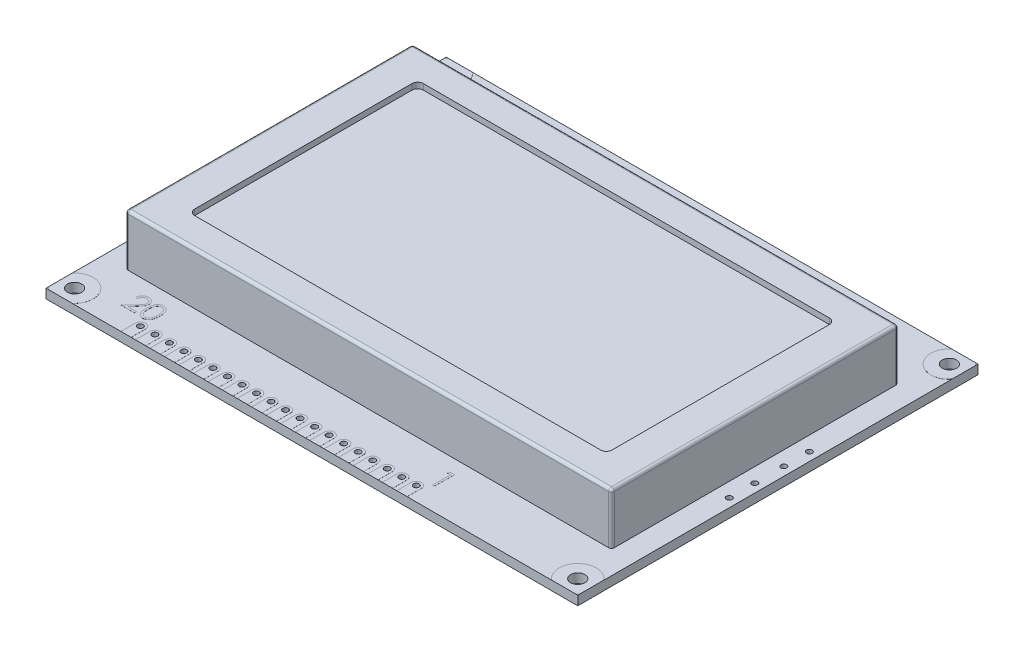
from build123d import *

# Parameters (mm, degrees)
SKETCH1_W                = 93
SKETCH1_H                = 70
SKETCH1_R                = 1.25
SKETCH1_R_2              = 0.5
BOSS_EXTRUDE1_DEPTH      = 1.6
BOSS_EXTRUDE2_DEPTH      = 1.61
BOSS_EXTRUDE2_DEPTH_BACK = 0.01
SKETCH4_R                = 0.5
SKETCH4_R_2              = 1.25
BOSS_EXTRUDE3_START      = 1.6
SKETCH5_W                = 85
SKETCH5_H                = 50.2
BOSS_EXTRUDE3_DEPTH      = 9
FILLET1_R                = 0.5
CUT_EXTRUDE1_START       = 10.6
CUT_EXTRUDE1_DEPTH       = 1
BOSS_EXTRUDE4_START      = 1.6
BOSS_EXTRUDE4_DEPTH      = 0.01
SKETCH8_R                = 7.5
BOSS_EXTRUDE5_DEPTH      = 3
FILLET2_R                = 9


with BuildPart() as part:
    # Sketch1 → Boss-Extrude1 (new body)
    with BuildSketch(Plane(origin=(0, 0, 0), x_dir=(1, 0, 0), z_dir=(0, 1, 0))):
        with Locations((46.5, 35)):
            Rectangle(SKETCH1_W, SKETCH1_H)
        with Locations(Location((2.5, 67.5, 0), (0, 0, 270))):
            Circle(SKETCH1_R, mode=Mode.SUBTRACT)
        with Locations(Location((90.5, 67.5, 0), (0, 0, 270))):
            Circle(SKETCH1_R, mode=Mode.SUBTRACT)
        with Locations(Location((90.5, 2.5, 0), (0, 0, 270))):
            Circle(SKETCH1_R, mode=Mode.SUBTRACT)
        with Locations(Location((2.5, 2.5, 0), (0, 0, 270))):
            Circle(SKETCH1_R, mode=Mode.SUBTRACT)
        with Locations(Location((14, 2.5, 0), (0, 0, 270))):
            Circle(SKETCH1_R_2, mode=Mode.SUBTRACT)
        with Locations(Location((16.54, 2.5, 0), (0, 0, 270))):
            Circle(SKETCH1_R_2, mode=Mode.SUBTRACT)
        with Locations(Location((19.08, 2.5, 0), (0, 0, 270))):
            Circle(SKETCH1_R_2, mode=Mode.SUBTRACT)
        with Locations(Location((21.62, 2.5, 0), (0, 0, 270))):
            Circle(SKETCH1_R_2, mode=Mode.SUBTRACT)
        with Locations(Location((24.16, 2.5, 0), (0, 0, 270))):
            Circle(SKETCH1_R_2, mode=Mode.SUBTRACT)
        with Locations(Location((26.7, 2.5, 0), (0, 0, 270))):
            Circle(SKETCH1_R_2, mode=Mode.SUBTRACT)
        with Locations(Location((29.24, 2.5, 0), (0, 0, 270))):
            Circle(SKETCH1_R_2, mode=Mode.SUBTRACT)
        with Locations(Location((31.78, 2.5, 0), (0, 0, 270))):
            Circle(SKETCH1_R_2, mode=Mode.SUBTRACT)
        with Locations(Location((34.32, 2.5, 0), (0, 0, 270))):
            Circle(SKETCH1_R_2, mode=Mode.SUBTRACT)
        with Locations(Location((36.86, 2.5, 0), (0, 0, 270))):
            Circle(SKETCH1_R_2, mode=Mode.SUBTRACT)
        with Locations(Location((39.4, 2.5, 0), (0, 0, 270))):
            Circle(SKETCH1_R_2, mode=Mode.SUBTRACT)
        with Locations(Location((41.94, 2.5, 0), (0, 0, 270))):
            Circle(SKETCH1_R_2, mode=Mode.SUBTRACT)
        with Locations(Location((44.48, 2.5, 0), (0, 0, 270))):
            Circle(SKETCH1_R_2, mode=Mode.SUBTRACT)
        with Locations(Location((47.02, 2.5, 0), (0, 0, 270))):
            Circle(SKETCH1_R_2, mode=Mode.SUBTRACT)
        with Locations(Location((49.56, 2.5, 0), (0, 0, 270))):
            Circle(SKETCH1_R_2, mode=Mode.SUBTRACT)
        with Locations(Location((52.1, 2.5, 0), (0, 0, 270))):
            Circle(SKETCH1_R_2, mode=Mode.SUBTRACT)
        with Locations(Location((54.64, 2.5, 0), (0, 0, 270))):
            Circle(SKETCH1_R_2, mode=Mode.SUBTRACT)
        with Locations(Location((57.18, 2.5, 0), (0, 0, 270))):
            Circle(SKETCH1_R_2, mode=Mode.SUBTRACT)
        with Locations(Location((59.72, 2.5, 0), (0, 0, 270))):
            Circle(SKETCH1_R_2, mode=Mode.SUBTRACT)
        with Locations(Location((62.26, 2.5, 0), (0, 0, 270))):
            Circle(SKETCH1_R_2, mode=Mode.SUBTRACT)
        with Locations(Location((91.5, 42, 0), (0, 0, 270))):
            Circle(SKETCH1_R_2, mode=Mode.SUBTRACT)
        with Locations(Location((91.5, 37.54, 0), (0, 0, 270))):
            Circle(SKETCH1_R_2, mode=Mode.SUBTRACT)
        with Locations(Location((91.5, 32.46, 0), (0, 0, 270))):
            Circle(SKETCH1_R_2, mode=Mode.SUBTRACT)
        with Locations(Location((91.5, 28, 0), (0, 0, 270))):
            Circle(SKETCH1_R_2, mode=Mode.SUBTRACT)
    extrude(amount=BOSS_EXTRUDE1_DEPTH)

    # Sketch4 → Boss-Extrude2 (add, two sides: drawn at the far end of the back side and taken through both)
    # profile 1 of 24: a face of its own
    with BuildSketch(Plane(origin=(0, 0, 0), x_dir=(1, 0, 0), z_dir=(0, 1, 0)).offset(-BOSS_EXTRUDE2_DEPTH_BACK)):
        with BuildLine():
            Line((13.1, 2.5), (13.1, 0))
            Line((13.1, 0), (14.9, 0))
            Line((14.9, 0), (14.9, 2.5))
            ThreePointArc((14.9, 2.5), (14, 3.4), (13.1, 2.5))
        make_face()
        with Locations(Location((14, 2.5, 0), (0, 0, 270))):
            Circle(SKETCH4_R, mode=Mode.SUBTRACT)
    # profile 2 of 24: a face of its own
    with BuildSketch(Plane(origin=(0, 0, 0), x_dir=(1, 0, 0), z_dir=(0, 1, 0)).offset(-BOSS_EXTRUDE2_DEPTH_BACK)):
        with BuildLine():
            Line((15.64, 2.5), (15.64, 0))
            Line((15.64, 0), (17.44, 0))
            Line((17.44, 0), (17.44, 2.5))
            ThreePointArc((17.44, 2.5), (16.54, 3.4), (15.64, 2.5))
        make_face()
        with Locations(Location((16.54, 2.5, 0), (0, 0, 270))):
            Circle(SKETCH4_R, mode=Mode.SUBTRACT)
    # profile 3 of 24: a face of its own
    with BuildSketch(Plane(origin=(0, 0, 0), x_dir=(1, 0, 0), z_dir=(0, 1, 0)).offset(-BOSS_EXTRUDE2_DEPTH_BACK)):
        with BuildLine():
            Line((18.18, 2.5), (18.18, 0))
            Line((18.18, 0), (19.98, 0))
            Line((19.98, 0), (19.98, 2.5))
            ThreePointArc((19.98, 2.5), (19.08, 3.4), (18.18, 2.5))
        make_face()
        with Locations(Location((19.08, 2.5, 0), (0, 0, 270))):
            Circle(SKETCH4_R, mode=Mode.SUBTRACT)
    # profile 4 of 24: a face of its own
    with BuildSketch(Plane(origin=(0, 0, 0), x_dir=(1, 0, 0), z_dir=(0, 1, 0)).offset(-BOSS_EXTRUDE2_DEPTH_BACK)):
        with BuildLine():
            Line((20.72, 2.5), (20.72, 0))
            Line((20.72, 0), (22.52, 0))
            Line((22.52, 0), (22.52, 2.5))
            ThreePointArc((22.52, 2.5), (21.62, 3.4), (20.72, 2.5))
        make_face()
        with Locations(Location((21.62, 2.5, 0), (0, 0, 270))):
            Circle(SKETCH4_R, mode=Mode.SUBTRACT)
    # profile 5 of 24: a face of its own
    with BuildSketch(Plane(origin=(0, 0, 0), x_dir=(1, 0, 0), z_dir=(0, 1, 0)).offset(-BOSS_EXTRUDE2_DEPTH_BACK)):
        with BuildLine():
            Line((23.26, 2.5), (23.26, 0))
            Line((23.26, 0), (25.06, 0))
            Line((25.06, 0), (25.06, 2.5))
            ThreePointArc((25.06, 2.5), (24.16, 3.4), (23.26, 2.5))
        make_face()
        with Locations(Location((24.16, 2.5, 0), (0, 0, 270))):
            Circle(SKETCH4_R, mode=Mode.SUBTRACT)
    # profile 6 of 24: a face of its own
    with BuildSketch(Plane(origin=(0, 0, 0), x_dir=(1, 0, 0), z_dir=(0, 1, 0)).offset(-BOSS_EXTRUDE2_DEPTH_BACK)):
        with BuildLine():
            Line((25.8, 2.5), (25.8, 0))
            Line((25.8, 0), (27.6, 0))
            Line((27.6, 0), (27.6, 2.5))
            ThreePointArc((27.6, 2.5), (26.7, 3.4), (25.8, 2.5))
        make_face()
        with Locations(Location((26.7, 2.5, 0), (0, 0, 270))):
            Circle(SKETCH4_R, mode=Mode.SUBTRACT)
    # profile 7 of 24: a face of its own
    with BuildSketch(Plane(origin=(0, 0, 0), x_dir=(1, 0, 0), z_dir=(0, 1, 0)).offset(-BOSS_EXTRUDE2_DEPTH_BACK)):
        with BuildLine():
            Line((28.34, 2.5), (28.34, 0))
            Line((28.34, 0), (30.14, 0))
            Line((30.14, 0), (30.14, 2.5))
            ThreePointArc((30.14, 2.5), (29.24, 3.4), (28.34, 2.5))
        make_face()
        with Locations(Location((29.24, 2.5, 0), (0, 0, 270))):
            Circle(SKETCH4_R, mode=Mode.SUBTRACT)
    # profile 8 of 24: a face of its own
    with BuildSketch(Plane(origin=(0, 0, 0), x_dir=(1, 0, 0), z_dir=(0, 1, 0)).offset(-BOSS_EXTRUDE2_DEPTH_BACK)):
        with BuildLine():
            Line((30.88, 2.5), (30.88, 0))
            Line((30.88, 0), (32.68, 0))
            Line((32.68, 0), (32.68, 2.5))
            ThreePointArc((32.68, 2.5), (31.78, 3.4), (30.88, 2.5))
        make_face()
        with Locations(Location((31.78, 2.5, 0), (0, 0, 270))):
            Circle(SKETCH4_R, mode=Mode.SUBTRACT)
    # profile 9 of 24: a face of its own
    with BuildSketch(Plane(origin=(0, 0, 0), x_dir=(1, 0, 0), z_dir=(0, 1, 0)).offset(-BOSS_EXTRUDE2_DEPTH_BACK)):
        with BuildLine():
            Line((33.42, 2.5), (33.42, 0))
            Line((33.42, 0), (35.22, 0))
            Line((35.22, 0), (35.22, 2.5))
            ThreePointArc((35.22, 2.5), (34.32, 3.4), (33.42, 2.5))
        make_face()
        with Locations(Location((34.32, 2.5, 0), (0, 0, 270))):
            Circle(SKETCH4_R, mode=Mode.SUBTRACT)
    # profile 10 of 24: a face of its own
    with BuildSketch(Plane(origin=(0, 0, 0), x_dir=(1, 0, 0), z_dir=(0, 1, 0)).offset(-BOSS_EXTRUDE2_DEPTH_BACK)):
        with BuildLine():
            Line((35.96, 2.5), (35.96, 0))
            Line((35.96, 0), (37.76, 0))
            Line((37.76, 0), (37.76, 2.5))
            ThreePointArc((37.76, 2.5), (36.86, 3.4), (35.96, 2.5))
        make_face()
        with Locations(Location((36.86, 2.5, 0), (0, 0, 270))):
            Circle(SKETCH4_R, mode=Mode.SUBTRACT)
    # profile 11 of 24: a face of its own
    with BuildSketch(Plane(origin=(0, 0, 0), x_dir=(1, 0, 0), z_dir=(0, 1, 0)).offset(-BOSS_EXTRUDE2_DEPTH_BACK)):
        with BuildLine():
            Line((38.5, 2.5), (38.5, 0))
            Line((38.5, 0), (40.3, 0))
            Line((40.3, 0), (40.3, 2.5))
            ThreePointArc((40.3, 2.5), (39.4, 3.4), (38.5, 2.5))
        make_face()
        with Locations(Location((39.4, 2.5, 0), (0, 0, 270))):
            Circle(SKETCH4_R, mode=Mode.SUBTRACT)
    # profile 12 of 24: a face of its own
    with BuildSketch(Plane(origin=(0, 0, 0), x_dir=(1, 0, 0), z_dir=(0, 1, 0)).offset(-BOSS_EXTRUDE2_DEPTH_BACK)):
        with BuildLine():
            Line((41.04, 2.5), (41.04, 0))
            Line((41.04, 0), (42.84, 0))
            Line((42.84, 0), (42.84, 2.5))
            ThreePointArc((42.84, 2.5), (41.94, 3.4), (41.04, 2.5))
        make_face()
        with Locations(Location((41.94, 2.5, 0), (0, 0, 270))):
            Circle(SKETCH4_R, mode=Mode.SUBTRACT)
    # profile 13 of 24: a face of its own
    with BuildSketch(Plane(origin=(0, 0, 0), x_dir=(1, 0, 0), z_dir=(0, 1, 0)).offset(-BOSS_EXTRUDE2_DEPTH_BACK)):
        with BuildLine():
            Line((43.58, 2.5), (43.58, 0))
            Line((43.58, 0), (45.38, 0))
            Line((45.38, 0), (45.38, 2.5))
            ThreePointArc((45.38, 2.5), (44.48, 3.4), (43.58, 2.5))
        make_face()
        with Locations(Location((44.48, 2.5, 0), (0, 0, 270))):
            Circle(SKETCH4_R, mode=Mode.SUBTRACT)
    # profile 14 of 24: a face of its own
    with BuildSketch(Plane(origin=(0, 0, 0), x_dir=(1, 0, 0), z_dir=(0, 1, 0)).offset(-BOSS_EXTRUDE2_DEPTH_BACK)):
        with BuildLine():
            Line((46.12, 2.5), (46.12, 0))
            Line((46.12, 0), (47.92, 0))
            Line((47.92, 0), (47.92, 2.5))
            ThreePointArc((47.92, 2.5), (47.02, 3.4), (46.12, 2.5))
        make_face()
        with Locations(Location((47.02, 2.5, 0), (0, 0, 270))):
            Circle(SKETCH4_R, mode=Mode.SUBTRACT)
    # profile 15 of 24: a face of its own
    with BuildSketch(Plane(origin=(0, 0, 0), x_dir=(1, 0, 0), z_dir=(0, 1, 0)).offset(-BOSS_EXTRUDE2_DEPTH_BACK)):
        with BuildLine():
            Line((48.66, 2.5), (48.66, 0))
            Line((48.66, 0), (50.46, 0))
            Line((50.46, 0), (50.46, 2.5))
            ThreePointArc((50.46, 2.5), (49.56, 3.4), (48.66, 2.5))
        make_face()
        with Locations(Location((49.56, 2.5, 0), (0, 0, 270))):
            Circle(SKETCH4_R, mode=Mode.SUBTRACT)
    # profile 16 of 24: a face of its own
    with BuildSketch(Plane(origin=(0, 0, 0), x_dir=(1, 0, 0), z_dir=(0, 1, 0)).offset(-BOSS_EXTRUDE2_DEPTH_BACK)):
        with BuildLine():
            Line((51.2, 2.5), (51.2, 0))
            Line((51.2, 0), (53, 0))
            Line((53, 0), (53, 2.5))
            ThreePointArc((53, 2.5), (52.1, 3.4), (51.2, 2.5))
        make_face()
        with Locations(Location((52.1, 2.5, 0), (0, 0, 270))):
            Circle(SKETCH4_R, mode=Mode.SUBTRACT)
    # profile 17 of 24: a face of its own
    with BuildSketch(Plane(origin=(0, 0, 0), x_dir=(1, 0, 0), z_dir=(0, 1, 0)).offset(-BOSS_EXTRUDE2_DEPTH_BACK)):
        with BuildLine():
            Line((53.74, 2.5), (53.74, 0))
            Line((53.74, 0), (55.54, 0))
            Line((55.54, 0), (55.54, 2.5))
            ThreePointArc((55.54, 2.5), (54.64, 3.4), (53.74, 2.5))
        make_face()
        with Locations(Location((54.64, 2.5, 0), (0, 0, 270))):
            Circle(SKETCH4_R, mode=Mode.SUBTRACT)
    # profile 18 of 24: a face of its own
    with BuildSketch(Plane(origin=(0, 0, 0), x_dir=(1, 0, 0), z_dir=(0, 1, 0)).offset(-BOSS_EXTRUDE2_DEPTH_BACK)):
        with BuildLine():
            Line((56.28, 2.5), (56.28, 0))
            Line((56.28, 0), (58.08, 0))
            Line((58.08, 0), (58.08, 2.5))
            ThreePointArc((58.08, 2.5), (57.18, 3.4), (56.28, 2.5))
        make_face()
        with Locations(Location((57.18, 2.5, 0), (0, 0, 270))):
            Circle(SKETCH4_R, mode=Mode.SUBTRACT)
    # profile 19 of 24: a face of its own
    with BuildSketch(Plane(origin=(0, 0, 0), x_dir=(1, 0, 0), z_dir=(0, 1, 0)).offset(-BOSS_EXTRUDE2_DEPTH_BACK)):
        with BuildLine():
            Line((58.82, 2.5), (58.82, 0))
            Line((58.82, 0), (60.62, 0))
            Line((60.62, 0), (60.62, 2.5))
            ThreePointArc((60.62, 2.5), (59.72, 3.4), (58.82, 2.5))
        make_face()
        with Locations(Location((59.72, 2.5, 0), (0, 0, 270))):
            Circle(SKETCH4_R, mode=Mode.SUBTRACT)
    # profile 20 of 24: a face of its own
    with BuildSketch(Plane(origin=(0, 0, 0), x_dir=(1, 0, 0), z_dir=(0, 1, 0)).offset(-BOSS_EXTRUDE2_DEPTH_BACK)):
        with BuildLine():
            Line((61.36, 2.5), (61.36, 0))
            Line((61.36, 0), (63.16, 0))
            Line((63.16, 0), (63.16, 2.5))
            ThreePointArc((63.16, 2.5), (62.26, 3.4), (61.36, 2.5))
        make_face()
        with Locations(Location((62.26, 2.5, 0), (0, 0, 270))):
            Circle(SKETCH4_R, mode=Mode.SUBTRACT)
    # profile 21 of 24: a face of its own
    with BuildSketch(Plane(origin=(0, 0, 0), x_dir=(1, 0, 0), z_dir=(0, 1, 0)).offset(-BOSS_EXTRUDE2_DEPTH_BACK)):
        with BuildLine():
            Line((0, 4.576655966), (0, 0.423344034))
            ThreePointArc((0, 0.423344034), (0.201902961, 0.201902961), (0.423344034, 0))
            Line((0.423344034, 0), (4.576655966, 0))
            ThreePointArc((4.576655966, 0), (4.798097039, 4.798097039), (0, 4.576655966))
        make_face()
        with Locations(Location((2.5, 2.5, 0), (0, 0, 270))):
            Circle(SKETCH4_R_2, mode=Mode.SUBTRACT)
    # profile 22 of 24: a face of its own
    with BuildSketch(Plane(origin=(0, 0, 0), x_dir=(1, 0, 0), z_dir=(0, 1, 0)).offset(-BOSS_EXTRUDE2_DEPTH_BACK)):
        with BuildLine():
            Line((4.576655966, 70), (0.423344034, 70))
            ThreePointArc((0.423344034, 70), (0.201902961, 69.798097039), (0, 69.576655966))
            Line((0, 69.576655966), (0, 65.423344034))
            ThreePointArc((0, 65.423344034), (4.798097039, 65.201902961), (4.576655966, 70))
        make_face()
        with Locations(Location((2.5, 67.5, 0), (0, 0, 270))):
            Circle(SKETCH4_R_2, mode=Mode.SUBTRACT)
    # profile 23 of 24: a face of its own
    with BuildSketch(Plane(origin=(0, 0, 0), x_dir=(1, 0, 0), z_dir=(0, 1, 0)).offset(-BOSS_EXTRUDE2_DEPTH_BACK)):
        with BuildLine():
            Line((88.423344034, 70), (92.576655966, 70))
            ThreePointArc((92.576655966, 70), (92.798097039, 69.798097039), (93, 69.576655966))
            Line((93, 69.576655966), (93, 65.423344034))
            ThreePointArc((93, 65.423344034), (88.201902961, 65.201902961), (88.423344034, 70))
        make_face()
        with Locations(Location((90.5, 67.5, 0), (0, 0, 270))):
            Circle(SKETCH4_R_2, mode=Mode.SUBTRACT)
    # profile 24 of 24: a face of its own
    with BuildSketch(Plane(origin=(0, 0, 0), x_dir=(1, 0, 0), z_dir=(0, 1, 0)).offset(-BOSS_EXTRUDE2_DEPTH_BACK)):
        with BuildLine():
            Line((88.423344034, 0), (92.576655966, 0))
            ThreePointArc((92.576655966, 0), (92.798097039, 0.201902961), (93, 0.423344034))
            Line((93, 0.423344034), (93, 4.576655966))
            ThreePointArc((93, 4.576655966), (88.201902961, 4.798097039), (88.423344034, 0))
        make_face()
        with Locations(Location((90.5, 2.5, 0), (0, 0, 270))):
            Circle(SKETCH4_R_2, mode=Mode.SUBTRACT)
    extrude(amount=BOSS_EXTRUDE2_DEPTH + BOSS_EXTRUDE2_DEPTH_BACK)

    # Sketch5 → Boss-Extrude3 (add)
    with BuildSketch(Plane(origin=(0, 0, 0), x_dir=(1, 0, 0), z_dir=(0, 1, 0)).offset(BOSS_EXTRUDE3_START)):
        with Locations((46.5, 35)):
            Rectangle(SKETCH5_W, SKETCH5_H)
    extrude(amount=BOSS_EXTRUDE3_DEPTH)

    # Fillet1
    fillet1_edges = [part.edges().sort_by_distance(p)[0] for p in [
        (4, 6.1, -9.9),
        (89, 6.1, -9.9),
        (89, 6.1, -60.1),
        (4, 6.1, -60.1),
        (46.5, 10.6, -9.9),
        (89, 10.6, -35),
        (46.5, 10.6, -60.1),
        (4, 10.6, -35),
    ]]
    fillet(fillet1_edges, radius=FILLET1_R)

    # Sketch6 → Cut-Extrude1 (cut)
    with BuildSketch(Plane(origin=(0, 0, 0), x_dir=(1, 0, 0), z_dir=(0, 1, 0)).offset(CUT_EXTRUDE1_START)):
        with BuildLine():
            Line((11, 55), (82, 55))
            ThreePointArc((82, 55), (82.707106781, 54.707106781), (83, 54))
            Line((83, 54), (83, 16))
            ThreePointArc((83, 16), (82.707106781, 15.292893219), (82, 15))
            Line((82, 15), (11, 15))
            ThreePointArc((11, 15), (10.292893219, 15.292893219), (10, 16))
            Line((10, 16), (10, 54))
            ThreePointArc((10, 54), (10.292893219, 54.707106781), (11, 55))
        make_face()
    extrude(amount=-CUT_EXTRUDE1_DEPTH, mode=Mode.SUBTRACT)

    # Sketch7 → Boss-Extrude4 (add)
    # profile 1 of 3: a face of its own
    with BuildSketch(Plane(origin=(0, 0, 0), x_dir=(1, 0, 0), z_dir=(0, 1, 0)).offset(BOSS_EXTRUDE4_START)):
        Polygon((63.31493189, 7.465834386), (63.962067306, 7.465834386), (63.962067306, 3.965834386), (63.647964742, 3.965834386), (63.647964742, 7.106860027), (63.109503204, 7.106860027), align=None)
    # profile 2 of 3: a face of its own
    with BuildSketch(Plane(origin=(0, 0, 0), x_dir=(1, 0, 0), z_dir=(0, 1, 0)).offset(BOSS_EXTRUDE4_START)):
        with BuildLine():
            Line((9.57822358, 6.421604631), (9.264121016, 6.421604631))
            add(Edge.make_bspline(
                [(9.264121016, 6.421604631), (9.266168169, 6.463275519), (9.270188723, 6.545116033), (9.289017012, 6.66443994), (9.315957889, 6.778494738), (9.354049343, 6.886364652), (9.401355621, 6.98900346), (9.458085649, 7.086003475), (9.525279499, 7.176994664), (9.601486233, 7.261133507), (9.684254872, 7.338321078), (9.773560812, 7.404976321), (9.867405839, 7.461293992), (9.965505238, 7.508375234), (10.068965801, 7.54371508), (10.176848659, 7.56993672), (10.289627796, 7.585713065), (10.366467818, 7.587408851), (10.405547298, 7.588271298)],
                knots=[0, 0, 0, 0, 1.10065271, 2.161652631, 3.183658789, 4.190468796, 5.17591951, 6.163126047, 7.15150782, 8.156236427, 9.156009102, 10.134482811, 11.092018607, 12.041330605, 13.001268258, 13.972401359, 14.968799086, 16, 16, 16, 16], degree=3))
            add(Edge.make_bspline(
                [(10.405547298, 7.588271298), (10.443925372, 7.587372841), (10.519336917, 7.585607406), (10.629398931, 7.570446377), (10.734176226, 7.546700786), (10.833463992, 7.513385369), (10.926470057, 7.468600942), (11.013893101, 7.414803403), (11.096773912, 7.352583572), (11.171380696, 7.279329758), (11.239888775, 7.201127374), (11.29899103, 7.11763947), (11.349604194, 7.031410185), (11.391791873, 6.941781983), (11.422848012, 6.847910955), (11.44642622, 6.751163752), (11.459753634, 6.650538941), (11.461799058, 6.582432385), (11.462838965, 6.547806554)],
                knots=[0, 0, 0, 0, 1.111607364, 2.184268762, 3.212621178, 4.221274766, 5.211760367, 6.196651075, 7.1921475, 8.207485113, 9.220403448, 10.201281604, 11.166441695, 12.114753415, 13.065576456, 14.026450734, 14.996634279, 16, 16, 16, 16], degree=3))
            add(Edge.make_bspline(
                [(11.462838965, 6.547806554), (11.461145702, 6.49905872), (11.45778889, 6.402418506), (11.429074514, 6.260403643), (11.384228003, 6.122810224), (11.330230646, 6.012072922), (11.275758202, 5.922839428), (11.226670694, 5.849370723), (11.169205883, 5.770265255), (11.102527385, 5.685787917), (11.028014513, 5.595277012), (10.94499235, 5.498787217), (10.852868868, 5.397315447), (10.788210367, 5.328009846), (10.754705952, 5.292097419)],
                knots=[0, 0, 0, 0, 1.184426356, 2.348067706, 3.509069118, 4.696110526, 5.333549288, 6.050745305, 6.844228056, 7.710549037, 8.667450064, 9.695053472, 10.805634456, 12, 12, 12, 12], degree=3))
            Line((10.754705952, 5.292097419), (9.87900483, 4.357502067))
            Line((9.87900483, 4.357502067), (11.50771076, 4.357502067))
            Line((11.50771076, 4.357502067), (11.50771076, 3.998527708))
            Line((11.50771076, 3.998527708), (9.129505631, 3.998527708))
            Line((9.129505631, 3.998527708), (10.486877426, 5.447045336))
            add(Edge.make_bspline(
                [(10.486877426, 5.447045336), (10.519925313, 5.481543643), (10.58340354, 5.547807829), (10.673186117, 5.644550789), (10.753825105, 5.73430033), (10.825842498, 5.816886879), (10.887676003, 5.893518446), (10.942548235, 5.96171315), (10.986513826, 6.0244676), (11.034229222, 6.097208214), (11.080443203, 6.186020531), (11.120155559, 6.294554221), (11.144370408, 6.406281473), (11.147275243, 6.48178351), (11.148736401, 6.519761682)],
                knots=[0, 0, 0, 0, 1.329631726, 2.553950428, 3.673215718, 4.687767853, 5.603093632, 6.413772471, 7.123043292, 7.734684054, 8.834405432, 9.900288307, 10.943827018, 12, 12, 12, 12], degree=3))
            add(Edge.make_bspline(
                [(11.148736401, 6.519761682), (11.148100658, 6.543643081), (11.146847732, 6.590708731), (11.135790035, 6.65971449), (11.119079529, 6.726279304), (11.095134271, 6.790607923), (11.063527531, 6.852053575), (11.025054151, 6.910691055), (10.980664087, 6.96738002), (10.929312818, 7.020533319), (10.872901298, 7.069214524), (10.813307048, 7.112338609), (10.750256944, 7.14837772), (10.684016822, 7.177921217), (10.614771353, 7.201096599), (10.542386608, 7.217155178), (10.467062591, 7.227237662), (10.415629096, 7.228601834), (10.389421497, 7.229296939)],
                knots=[0, 0, 0, 0, 0.991446411, 1.95395049, 2.89581595, 3.838931463, 4.798493298, 5.75982156, 6.748411868, 7.785213223, 8.824556874, 9.840280684, 10.836137867, 11.835679398, 12.848801643, 13.863922112, 14.911575587, 16, 16, 16, 16], degree=3))
            add(Edge.make_bspline(
                [(10.389421497, 7.229296939), (10.362050664, 7.228581906), (10.308298868, 7.227177701), (10.229379835, 7.217355037), (10.154094057, 7.200409197), (10.082252154, 7.177232522), (10.013732568, 7.147773974), (9.948868524, 7.111082229), (9.887805635, 7.067298736), (9.830429112, 7.017658179), (9.777565133, 6.962390578), (9.731118257, 6.900780615), (9.690534243, 6.8339532), (9.655125009, 6.762088649), (9.626369319, 6.684534869), (9.604396169, 6.601567164), (9.587009322, 6.513545783), (9.581200801, 6.452760698), (9.57822358, 6.421604631)],
                knots=[0, 0, 0, 0, 1.031018746, 2.02475058, 2.990194455, 3.934040569, 4.864654155, 5.795059489, 6.735614925, 7.690564532, 8.649604399, 9.611025574, 10.590972636, 11.591080095, 12.624614302, 13.701020113, 14.821632451, 16, 16, 16, 16], degree=3))
        make_face()
    # profile 3 of 3: a face of its own
    with BuildSketch(Plane(origin=(0, 0, 0), x_dir=(1, 0, 0), z_dir=(0, 1, 0)).offset(BOSS_EXTRUDE4_START)):
        with BuildLine():
            add(Edge.make_bspline(
                [(11.821813324, 5.747125464), (11.822141342, 5.803222852), (11.822778522, 5.912192836), (11.829866943, 6.070977478), (11.841642285, 6.219937767), (11.857779658, 6.359080833), (11.877417638, 6.488442598), (11.903633125, 6.607677355), (11.933445927, 6.717336962), (11.967998373, 6.81777901), (12.006986162, 6.910356713), (12.049420423, 6.996781914), (12.096985217, 7.076923847), (12.14696213, 7.152061637), (12.201374202, 7.220965332), (12.258672992, 7.284607995), (12.321094869, 7.341518745), (12.386517877, 7.393365047), (12.455534341, 7.438814519), (12.526177007, 7.478847258), (12.598932113, 7.513047125), (12.673998296, 7.539937561), (12.750700854, 7.562148408), (12.829307921, 7.577337355), (12.909949285, 7.586894264), (12.964380719, 7.587807931), (12.991985599, 7.588271298)],
                knots=[0, 0, 0, 0, 1.646270934, 3.197905019, 4.663502075, 6.030701355, 7.308322542, 8.50163776, 9.611534131, 10.641858119, 11.616356847, 12.558055219, 13.465016945, 14.349605745, 15.204443733, 16.039544428, 16.859896111, 17.680448484, 18.487036065, 19.28249412, 20.06191084, 20.843045899, 21.620316918, 22.403196591, 23.190181807, 24, 24, 24, 24], degree=3))
            add(Edge.make_bspline(
                [(12.991985599, 7.588271298), (13.019821078, 7.587783483), (13.075177087, 7.586813372), (13.157017462, 7.577489429), (13.236967144, 7.562018306), (13.314685282, 7.540097331), (13.390810269, 7.512901655), (13.464746676, 7.478814538), (13.536953758, 7.43913567), (13.606284046, 7.392511793), (13.673498661, 7.340529517), (13.736946624, 7.281766848), (13.79663371, 7.216817129), (13.853309015, 7.146375265), (13.905364612, 7.06909018), (13.954938045, 6.98630607), (13.999310081, 6.896575205), (14.042044756, 6.801394738), (14.078931742, 6.698131079), (14.112197988, 6.587366318), (14.139076956, 6.467792131), (14.161466229, 6.340035886), (14.178811125, 6.203628403), (14.191443767, 6.058862087), (14.198116852, 5.905641697), (14.199373553, 5.800883847), (14.200018452, 5.747125464)],
                knots=[0, 0, 0, 0, 0.810914788, 1.612654377, 2.396697861, 3.181598691, 3.963628158, 4.749916497, 5.551656086, 6.361998678, 7.18212741, 8.025565596, 8.878627764, 9.750805457, 10.657531673, 11.591944965, 12.560506719, 13.57287815, 14.630710178, 15.753379473, 16.941251878, 18.199788006, 19.531962791, 20.947069417, 22.433333509, 24, 24, 24, 24], degree=3))
            add(Edge.make_bspline(
                [(14.200018452, 5.747125464), (14.199366867, 5.693601556), (14.198097281, 5.589312405), (14.191518575, 5.436781429), (14.178559943, 5.292783386), (14.162349955, 5.156972923), (14.139898992, 5.029915305), (14.112293826, 4.911170856), (14.081643503, 4.800226785), (14.043808709, 4.697991973), (14.002397999, 4.60304025), (13.957342802, 4.514373102), (13.909072976, 4.431206809), (13.856484231, 4.354207062), (13.800430818, 4.282828405), (13.739713029, 4.218330782), (13.676042444, 4.15916011), (13.608630028, 4.106508483), (13.538218477, 4.060423678), (13.4662594, 4.019209828), (13.391476017, 3.985977133), (13.315563064, 3.957442092), (13.237434698, 3.93564164), (13.157188307, 3.920567784), (13.075232071, 3.909995936), (13.019830506, 3.909189456), (12.991985599, 3.908784118)],
                knots=[0, 0, 0, 0, 1.561518951, 3.042555995, 4.452378317, 5.7783523, 7.031515105, 8.214008947, 9.334062868, 10.386615937, 11.391082383, 12.354592575, 13.286541444, 14.194233754, 15.072674879, 15.931287219, 16.775624067, 17.606195743, 18.42308326, 19.229000347, 20.022332153, 20.807536673, 21.593273796, 22.3848459, 23.188221202, 24, 24, 24, 24], degree=3))
            add(Edge.make_bspline(
                [(12.991985599, 3.908784118), (12.964381485, 3.909250474), (12.909951561, 3.910170036), (12.829299135, 3.919683767), (12.751016692, 3.93497927), (12.674717938, 3.956395874), (12.600011423, 3.982610711), (12.527915136, 4.016764394), (12.457627452, 4.056098463), (12.389335896, 4.100893885), (12.324323735, 4.152215568), (12.26222513, 4.208979857), (12.204600111, 4.272603268), (12.150966015, 4.342081191), (12.099991927, 4.416774433), (12.053102554, 4.497702806), (12.009731699, 4.584545417), (11.970088209, 4.677863327), (11.934939545, 4.779018255), (11.903891837, 4.889167434), (11.87937768, 5.00928307), (11.858394724, 5.138400437), (11.841470341, 5.277074367), (11.829916016, 5.425380146), (11.822774701, 5.583225355), (11.822139631, 5.691495129), (11.821813324, 5.747125464)],
                knots=[0, 0, 0, 0, 0.810891512, 1.598919785, 2.382837074, 3.152667961, 3.926044502, 4.706494248, 5.493654104, 6.291793342, 7.103789334, 7.925228297, 8.761435821, 9.622817696, 10.50288917, 11.416980706, 12.369136599, 13.353924996, 14.394355917, 15.514179734, 16.714354668, 17.994756427, 19.357759367, 20.818452758, 22.365282078, 24, 24, 24, 24], degree=3))
        make_face()
        with BuildLine():
            add(Edge.make_bspline(
                [(12.135915888, 5.748527708), (12.136035335, 5.701779009), (12.136267158, 5.611048964), (12.142323359, 5.479205703), (12.150573591, 5.356235375), (12.161214888, 5.241981838), (12.177017836, 5.136831826), (12.194724624, 5.040062143), (12.216272714, 4.952184905), (12.241767732, 4.872597095), (12.270806829, 4.799948026), (12.302512692, 4.732346811), (12.336573415, 4.668994875), (12.374692566, 4.610461266), (12.416207629, 4.556555102), (12.460180888, 4.50632227), (12.508253472, 4.461525289), (12.574757215, 4.407798433), (12.662553689, 4.3522793), (12.773174145, 4.30393321), (12.886842595, 4.273550754), (12.963993846, 4.269686998), (13.002502426, 4.267758477)],
                knots=[0, 0, 0, 0, 1.459021318, 2.831673884, 4.118529203, 5.306027144, 6.411944654, 7.436330062, 8.375795394, 9.233974572, 10.042671642, 10.816086306, 11.563610507, 12.285937304, 12.993564865, 13.685989202, 14.367179055, 15.041617293, 16.353048772, 17.594441528, 18.799311195, 20, 20, 20, 20], degree=3))
            add(Edge.make_bspline(
                [(13.002502426, 4.267758477), (13.041260098, 4.269356258), (13.118695421, 4.272548521), (13.231829216, 4.303347258), (13.341659486, 4.349816798), (13.427731427, 4.404764303), (13.49321397, 4.457092632), (13.54013096, 4.501707281), (13.583193009, 4.551663148), (13.624035083, 4.605562444), (13.661494159, 4.664434928), (13.695557297, 4.727997503), (13.726640644, 4.796426681), (13.74434969, 4.84419642), (13.753403868, 4.868619855)],
                knots=[0, 0, 0, 0, 1.353760809, 2.704726607, 4.075137775, 5.516104923, 6.260822281, 7.007110065, 7.778089737, 8.566572457, 9.372053459, 10.217411131, 11.088608312, 12, 12, 12, 12], degree=3))
            add(Edge.make_bspline(
                [(13.753403868, 4.868619855), (13.763955636, 4.899849595), (13.78538025, 4.963259359), (13.812992024, 5.061623011), (13.834737424, 5.164825775), (13.854300789, 5.272250892), (13.867653845, 5.384690593), (13.878401659, 5.501796977), (13.884732345, 5.623658339), (13.885517097, 5.70645333), (13.885915888, 5.748527708)],
                knots=[0, 0, 0, 0, 0.884706709, 1.796334032, 2.740027952, 3.714592787, 4.726048262, 5.777819803, 6.87074269, 8, 8, 8, 8], degree=3))
            add(Edge.make_bspline(
                [(13.885915888, 5.748527708), (13.885365698, 5.79059528), (13.884289411, 5.872888445), (13.880175423, 5.993406626), (13.869551849, 6.107874387), (13.85775273, 6.216784859), (13.840355509, 6.319535162), (13.821597702, 6.416985467), (13.796396489, 6.507928492), (13.769476714, 6.593788074), (13.738666319, 6.673588728), (13.704750585, 6.747702515), (13.668528826, 6.81648724), (13.629186585, 6.879754181), (13.587190902, 6.937786724), (13.541433353, 6.989421319), (13.49372898, 7.036258287), (13.426911795, 7.089720856), (13.339437505, 7.144232551), (13.230591857, 7.194398311), (13.117321213, 7.223206604), (13.040747759, 7.227268291), (13.002502426, 7.229296939)],
                knots=[0, 0, 0, 0, 1.31362396, 2.569729283, 3.763502607, 4.902122613, 5.988968491, 7.01645872, 7.998833611, 8.933434873, 9.825090667, 10.667526885, 11.477055099, 12.250526234, 12.991942729, 13.710640831, 14.402115721, 15.076753259, 16.378508321, 17.609869233, 18.806226677, 20, 20, 20, 20], degree=3))
            add(Edge.make_bspline(
                [(13.002502426, 7.229296939), (12.963791834, 7.227265492), (12.886300128, 7.223198898), (12.771852174, 7.194505644), (12.662147822, 7.144492678), (12.574904847, 7.089540306), (12.508041061, 7.037201995), (12.460958368, 6.99181554), (12.416812195, 6.942169286), (12.376144495, 6.887767371), (12.338055212, 6.829302004), (12.303074199, 6.766313239), (12.27155687, 6.698481875), (12.242472334, 6.62586544), (12.216899546, 6.546284495), (12.195805582, 6.458515502), (12.176318529, 6.36205361), (12.16252326, 6.256334102), (12.150259505, 6.142051948), (12.142378157, 6.01877463), (12.136246899, 5.88671025), (12.136028435, 5.795511091), (12.135915888, 5.748527708)],
                knots=[0, 0, 0, 0, 1.207732386, 2.417664972, 3.655092373, 4.956220595, 5.625982001, 6.301752483, 6.994047911, 7.697131622, 8.419323945, 9.170223765, 9.943494443, 10.752040957, 11.610060368, 12.549350801, 13.567764191, 14.679664412, 15.874934091, 17.154273443, 18.533957287, 20, 20, 20, 20], degree=3))
        make_face(mode=Mode.SUBTRACT)
    extrude(amount=BOSS_EXTRUDE4_DEPTH)

    # Sketch8 → Boss-Extrude5 (add)
    with BuildSketch(Plane(origin=(0, 0, 0), x_dir=(1, 0, 0), z_dir=(0, 1, 0))):
        with Locations(Location((19.375129734, 34.163780493, 0), (0, 0, 270))):
            Circle(SKETCH8_R)
        with Locations(Location((38.6081784, 39.285624975, 0), (0, 0, 270))):
            Circle(SKETCH8_R)
        with Locations(Location((59.304611205, 35.418109754, 0), (0, 0, 270))):
            Circle(SKETCH8_R)
    extrude(amount=-BOSS_EXTRUDE5_DEPTH)

    # Fillet2
    # the kernel refuses this fillet: 9 mm, written as the material it takes off along each edge
    with BuildSketch(Plane(origin=(38.6081784, -3, -39.285624975), x_dir=(0, 0, 1), z_dir=(-1, 0, 0))) as fillet2_piece_1:
        with BuildLine():
            CenterArc((0.791796068, 9), FILLET2_R, 270, 48.189685104)
            Line((0.791796068, 0), (0.791796068, -0.18))
            Line((0.791796068, -0.18), (7.5, -0.18))
            Line((7.5, -0.18), (7.68, 0))
            ThreePointArc((7.68, 0), (7.68, 1.5), (7.634164079, 2.88))
            Line((7.634164079, 2.88), (7.5, 3))
        make_face()
    revolve(axis=Axis((38.6081784, -3, -39.285624975), (0, 1, 0)), mode=Mode.SUBTRACT)
    with BuildSketch(Plane(origin=(59.304611205, -3, -35.418109754), x_dir=(0, 0, 1), z_dir=(-1, 0, 0))) as fillet2_piece_2:
        with BuildLine():
            CenterArc((0.791796068, 9), FILLET2_R, 270, 48.189685104)
            Line((0.791796068, 0), (0.791796068, -0.18))
            Line((0.791796068, -0.18), (7.5, -0.18))
            Line((7.5, -0.18), (7.68, 0))
            ThreePointArc((7.68, 0), (7.68, 1.5), (7.634164079, 2.88))
            Line((7.634164079, 2.88), (7.5, 3))
        make_face()
    revolve(axis=Axis((59.304611205, -3, -35.418109754), (0, 1, 0)), mode=Mode.SUBTRACT)
    with BuildSketch(Plane(origin=(19.375129734, -3, -34.163780493), x_dir=(0, 0, 1), z_dir=(-1, 0, 0))) as fillet2_piece_3:
        with BuildLine():
            CenterArc((0.791796068, 9), FILLET2_R, 270, 48.189685104)
            Line((0.791796068, 0), (0.791796068, -0.18))
            Line((0.791796068, -0.18), (7.5, -0.18))
            Line((7.5, -0.18), (7.68, 0))
            ThreePointArc((7.68, 0), (7.68, 1.5), (7.634164079, 2.88))
            Line((7.634164079, 2.88), (7.5, 3))
        make_face()
    revolve(axis=Axis((19.375129734, -3, -34.163780493), (0, 1, 0)), mode=Mode.SUBTRACT)


solid = part.part
